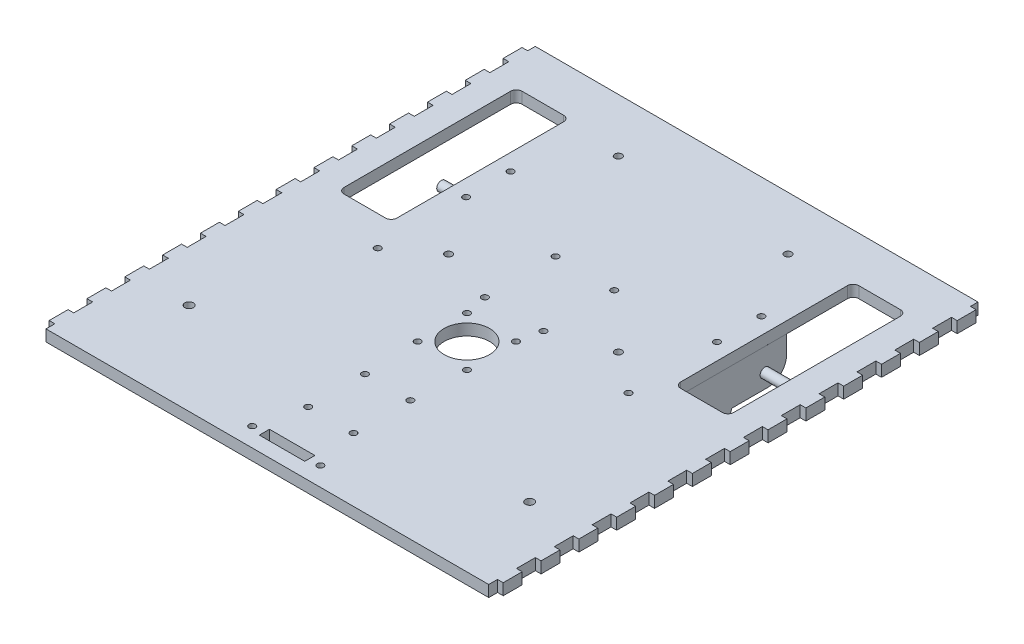
from build123d import *
from build123d.topology import SkipClean

# Parameters (mm, degrees)
SKETCH2_W                = 234
SKETCH2_H                = 258.598214609
SKETCH2_W_2              = 28
SKETCH2_H_2              = 94.123856443
BOSS_EXTRUDE1_DEPTH      = 6
BOSS_EXTRUDE3_DEPTH      = 1.6129
SKETCH6_R                = 1.27
SKETCH6_R_2              = 3
SKETCH6_R_3              = 2.55
BOSS_EXTRUDE4_DEPTH      = 1.6129
SKETCH13_W               = 3
SKETCH13_H               = 10
BOSS_EXTRUDE7_DEPTH      = 6
SKETCH7_R                = 1.7
SKETCH7_R_2              = 1.9
SKETCH7_R_3              = 2.25
SKETCH7_W                = 12
SKETCH7_H                = 5.356881788
CUT_EXTRUDE1_DEPTH       = 10
BOSS_EXTRUDE6_DEPTH      = 169
BOSS_EXTRUDE6_DEPTH_BACK = 21
SKETCH9_R                = 2.5
FILLET1_R                = 3


with BuildPart() as part:
    # Sketch2 → Boss-Extrude1 (new body)
    with BuildSketch(Plane(origin=(0, 0, 0), x_dir=(1, 0, 0), z_dir=(0, 1, 0))):
        with Locations((-69.266187111, 41.085004396)):
            Rectangle(SKETCH2_W, SKETCH2_H)
        with Locations((-158.266187111, 99.322183479)):
            Rectangle(SKETCH2_W_2, SKETCH2_H_2, mode=Mode.SUBTRACT)
        with Locations((19.733812889, 99.322183479)):
            Rectangle(SKETCH2_W_2, SKETCH2_H_2, mode=Mode.SUBTRACT)
    extrude(amount=BOSS_EXTRUDE1_DEPTH)

    # Sketch13 → Boss-Extrude7 (add)
    with BuildSketch(Plane(origin=(0, 6, 0), x_dir=(1, 0, 0), z_dir=(0, 1, 0))):
        with Locations((49.233812889, 161.3841117)):
            Rectangle(SKETCH13_W, SKETCH13_H)
        with Locations((49.233812889, 141.388949369)):
            Rectangle(SKETCH13_W, SKETCH13_H)
        with Locations((49.233812889, 121.393787037)):
            Rectangle(SKETCH13_W, SKETCH13_H)
        with Locations((49.233812889, 101.398624705)):
            Rectangle(SKETCH13_W, SKETCH13_H)
        with Locations((49.233812889, 81.403462374)):
            Rectangle(SKETCH13_W, SKETCH13_H)
        with Locations((49.233812889, 61.408300042)):
            Rectangle(SKETCH13_W, SKETCH13_H)
        with Locations((49.233812889, 41.413137711)):
            Rectangle(SKETCH13_W, SKETCH13_H)
        with Locations((49.233812889, 21.417975379)):
            Rectangle(SKETCH13_W, SKETCH13_H)
        with Locations((49.233812889, 1.422813048)):
            Rectangle(SKETCH13_W, SKETCH13_H)
        with Locations((49.233812889, -18.572349284)):
            Rectangle(SKETCH13_W, SKETCH13_H)
        with Locations((49.233812889, -38.567511615)):
            Rectangle(SKETCH13_W, SKETCH13_H)
        with Locations((49.233812889, -58.562673947)):
            Rectangle(SKETCH13_W, SKETCH13_H)
        with Locations((49.233812889, -78.557836278)):
            Rectangle(SKETCH13_W, SKETCH13_H)
        with Locations((-187.766187111, -78.557836278)):
            Rectangle(SKETCH13_W, SKETCH13_H)
        with Locations((-187.766187111, -58.562673947)):
            Rectangle(SKETCH13_W, SKETCH13_H)
        with Locations((-187.766187111, -38.567511615)):
            Rectangle(SKETCH13_W, SKETCH13_H)
        with Locations((-187.766187111, -18.572349284)):
            Rectangle(SKETCH13_W, SKETCH13_H)
        with Locations((-187.766187111, 1.422813048)):
            Rectangle(SKETCH13_W, SKETCH13_H)
        with Locations((-187.766187111, 21.417975379)):
            Rectangle(SKETCH13_W, SKETCH13_H)
        with Locations((-187.766187111, 41.413137711)):
            Rectangle(SKETCH13_W, SKETCH13_H)
        with Locations((-187.766187111, 61.408300042)):
            Rectangle(SKETCH13_W, SKETCH13_H)
        with Locations((-187.766187111, 81.403462374)):
            Rectangle(SKETCH13_W, SKETCH13_H)
        with Locations((-187.766187111, 101.398624705)):
            Rectangle(SKETCH13_W, SKETCH13_H)
        with Locations((-187.766187111, 121.393787037)):
            Rectangle(SKETCH13_W, SKETCH13_H)
        with Locations((-187.766187111, 141.388949369)):
            Rectangle(SKETCH13_W, SKETCH13_H)
        with Locations((-187.766187111, 161.3841117)):
            Rectangle(SKETCH13_W, SKETCH13_H)
    extrude(amount=-BOSS_EXTRUDE7_DEPTH)


with BuildPart() as body_2:
    # Sketch4 → Boss-Extrude3 (new body)
    with BuildSketch(Plane.XZ):
        with BuildLine():
            Line((-144.267333078, -111.229721788), (-144.267333078, -31.67181992))
            Line((-144.267333078, -31.67181992), (-131.429884942, -31.67181992))
            ThreePointArc((-131.429884942, -31.67181992), (-127.894351036, -33.136286014), (-126.429884942, -36.67181992))
            Line((-126.429884942, -36.67181992), (-126.429884942, -60.433571732))
            Line((-126.429884942, -60.433571732), (-89.180673519, -60.433571732))
            Line((-89.180673519, -60.433571732), (-89.180673519, -37.931289086))
            Line((-89.180673519, -37.931289086), (-80.766187111, -37.931289086))
            Line((-80.766187111, -37.931289086), (-80.766187111, -84.232527977))
            Line((-80.766187111, -84.232527977), (-89.180673519, -84.232527977))
            Line((-89.180673519, -84.232527977), (-89.180673519, -67.120259162))
            Line((-89.180673519, -67.120259162), (-126.426749597, -67.120259162))
            Line((-126.426749597, -67.120259162), (-126.426749597, -106.229721788))
            ThreePointArc((-126.426749597, -106.229721788), (-127.891215691, -109.765255694), (-131.426749597, -111.229721788))
            Line((-131.426749597, -111.229721788), (-144.267333078, -111.229721788))
        make_face()
    extrude(amount=BOSS_EXTRUDE3_DEPTH)

    # Sketch6 → Boss-Extrude4 (add)
    with BuildSketch(Plane(origin=(-144.267333078, 113.834921078, 0), x_dir=(0, -1, 0), z_dir=(1, 0, 0))):
        with BuildLine():
            Line((113.834921078, 111.229721788), (113.834921078, 31.67181992))
            Line((113.834921078, 31.67181992), (115.447821078, 31.67181992))
            Line((115.447821078, 31.67181992), (132.436476957, 35.606170437))
            ThreePointArc((132.436476957, 35.606170437), (151.461048761, 58.546855783), (133.404101078, 82.256685324))
            Line((133.404101078, 82.256685324), (133.404101078, 101.229721788))
            ThreePointArc((133.404101078, 101.229721788), (130.47516889, 108.3007896), (123.404101078, 111.229721788))
            Line((123.404101078, 111.229721788), (113.834921078, 111.229721788))
        make_face()
        with Locations((133.404101078, 71.838631562)):
            Circle(SKETCH6_R, mode=Mode.SUBTRACT)
        with Locations((123.193301078, 49.664431562)):
            Circle(SKETCH6_R, mode=Mode.SUBTRACT)
        with Locations((133.404101078, 49.664431562)):
            Circle(SKETCH6_R_2, mode=Mode.SUBTRACT)
        with Locations((143.614901078, 49.664431562)):
            Circle(SKETCH6_R, mode=Mode.SUBTRACT)
        with Locations((125.834921078, 99.788179708)):
            Circle(SKETCH6_R_3, mode=Mode.SUBTRACT)
    extrude(amount=BOSS_EXTRUDE4_DEPTH)


with BuildPart() as cut_extrude1_tool:
    # Sketch7 → Cut-Extrude1 (new, symmetric)
    with BuildSketch(Plane.XZ):
        with Locations((-135.546259235, -83.109800249)):
            Circle(SKETCH7_R)
        with Locations((-135.546259235, -36.397683325)):
            Circle(SKETCH7_R)
        with Locations((-84.752061213, -42.21938946)):
            Circle(SKETCH7_R)
        with Locations((-84.752061213, -79.62237987)):
            Circle(SKETCH7_R)
        with Locations((-135.546259235, -106.617187947)):
            Circle(SKETCH7_R)
        with Locations((-114.116187111, -52.429944497)):
            Circle(SKETCH7_R_2)
        with Locations((-114.116187111, -142.129944497)):
            Circle(SKETCH7_R_2)
        with Locations((-159.266187111, 39.570055503)):
            Circle(SKETCH7_R_3)
        with Locations((-82.266187111, -4.229944497)):
            Circle(SKETCH7_R)
        with Locations((-82.266187111, -30.229944497)):
            Circle(SKETCH7_R)
        with Locations((-87.266187111, 78.214102909)):
            Circle(SKETCH7_R)
        with Locations((-81.266187111, 24.634898886)):
            Circle(SKETCH7_R)
        with Locations((-81.266187111, 54.634898886)):
            Circle(SKETCH7_R)
        with BuildLine():
            Line((-69.266187111, -5.229944497), (-69.266187111, -29.229944497))
            ThreePointArc((-69.266187111, -29.229944497), (-81.266187111, -17.229944497), (-69.266187111, -5.229944497))
        make_face()
        with Locations((-75.266187111, 77.779311165)):
            Rectangle(SKETCH7_W, SKETCH7_H)
    cut_extrude1 = extrude(amount=CUT_EXTRUDE1_DEPTH, both=True)


with BuildPart() as part_1:
    add(part.part)

    # Cut-Extrude1: cut by cut_extrude1_tool
    add(cut_extrude1_tool.part, mode=Mode.SUBTRACT)

    # Mirror2: Cut-Extrude1 across plane
    with SkipClean():  # the faces are left unmerged after this step: merging them gives an invalid solid
        add(cut_extrude1.mirror(Plane.ZY.offset(69.266187111)), mode=Mode.SUBTRACT)

    # Fillet1
    fillet1_edges = [part_1.edges().sort_by_distance(p)[0] for p in [
        (-144.266187111, 3, -52.260255257),
        (-172.266187111, 3, -146.3841117),
        (-172.266187111, 3, -52.260255257),
        (-144.266187111, 3, -146.3841117),
        (33.733812889, 3, -146.3841117),
        (5.733812889, 3, -146.3841117),
        (33.733812889, 3, -52.260255257),
        (5.733812889, 3, -52.260255257),
    ]]
    fillet(fillet1_edges, radius=FILLET1_R)


with BuildPart() as body_2_1:
    add(body_2.part)

    # Cut-Extrude1: cut by cut_extrude1_tool
    add(cut_extrude1_tool.part, mode=Mode.SUBTRACT)


with BuildPart() as body_3:
    # Mirror1: mirrored copy
    add(body_2_1.part.mirror(Plane.ZY.offset(69.266187111)))


with BuildPart() as body_4:
    # Sketch9 → Boss-Extrude6 (new, two sides: drawn at the far end of the back side and taken through both)
    with BuildSketch(Plane(origin=(-144.266187111, 0, 0), x_dir=(0, 0, -1), z_dir=(1, 0, 0)).offset(-BOSS_EXTRUDE6_DEPTH_BACK)):
        with Locations((99.788179708, -12)):
            Circle(SKETCH9_R)
    extrude(amount=BOSS_EXTRUDE6_DEPTH + BOSS_EXTRUDE6_DEPTH_BACK)


solid = Compound([part_1.part, body_2_1.part, body_3.part, body_4.part])
